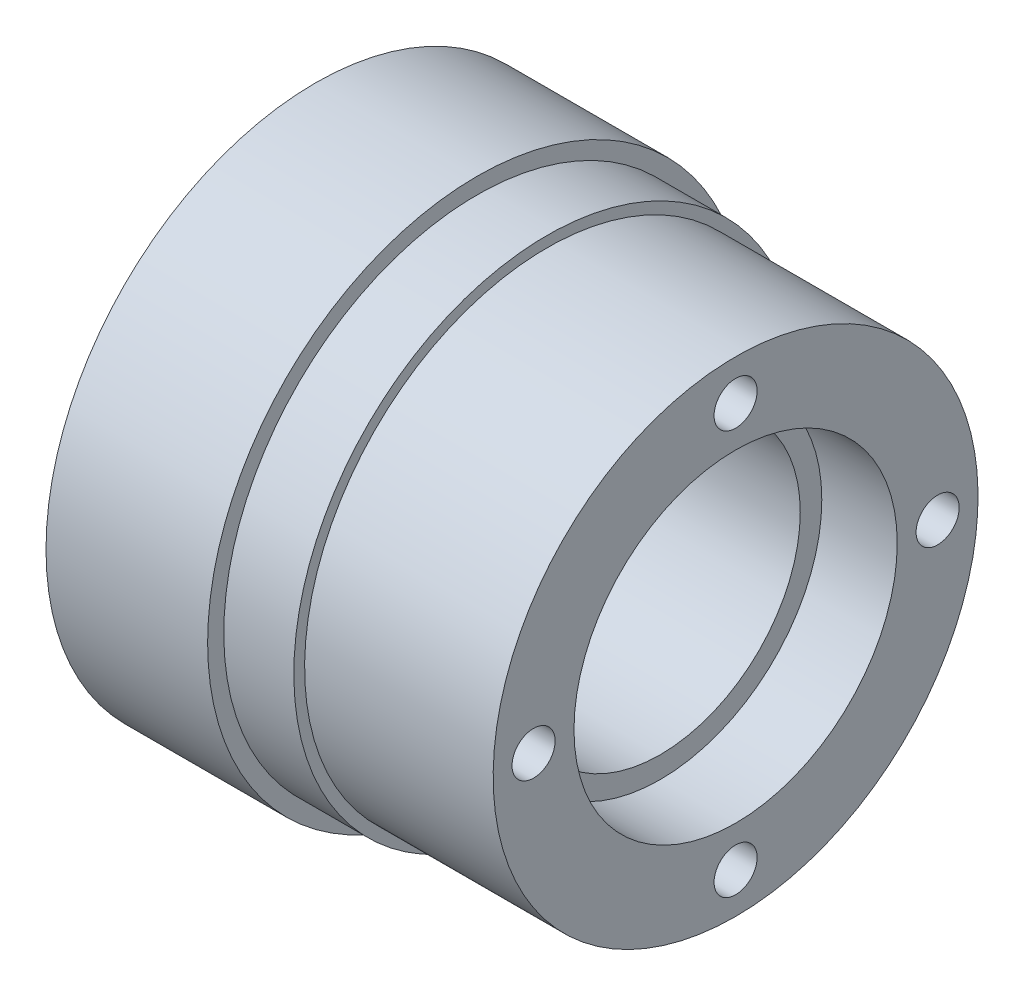
from build123d import *

# Parameters (mm, degrees)
SKETCH2_R          = 2
CUT_EXTRUDE1_DEPTH = 10
SKETCH3_R          = 2
CUT_EXTRUDE2_DEPTH = 10


with BuildPart() as part:
    # Sketch1 → Revolve1 (revolve)
    with BuildSketch(Plane.XY):
        Polygon((-19.5, 13.5), (-15.3, 13.5), (-15.3, 13), (12.5, 13), (12.5, 15), (19.5, 15), (19.5, 22.5), (2, 22.5), (2, 23.5), (-4.5, 23.5), (-4.5, 25), (-19.5, 25), align=None)
    revolve(axis=Axis((-19.5, 0, 0), (1, 0, 0)))

    # Sketch2 → Cut-Extrude1 (cut)
    with BuildSketch(Plane(origin=(19.5, 0, 0), x_dir=(0, 0, -1), z_dir=(1, 0, 0))):
        with Locations((0, 18.75)):
            Circle(SKETCH2_R)
        with Locations((18.75, 0)):
            Circle(SKETCH2_R)
        with Locations((0, -18.75)):
            Circle(SKETCH2_R)
        with Locations((-18.75, 0)):
            Circle(SKETCH2_R)
    extrude(amount=-CUT_EXTRUDE1_DEPTH, mode=Mode.SUBTRACT)

    # Sketch3 → Cut-Extrude2 (cut)
    with BuildSketch(Plane.ZY.offset(19.5)):
        with Locations((0, 19.25)):
            Circle(SKETCH3_R)
        with Locations((19.25, 0)):
            Circle(SKETCH3_R)
        with Locations((0, -19.25)):
            Circle(SKETCH3_R)
        with Locations((-19.25, 0)):
            Circle(SKETCH3_R)
    extrude(amount=-CUT_EXTRUDE2_DEPTH, mode=Mode.SUBTRACT)


solid = part.part
